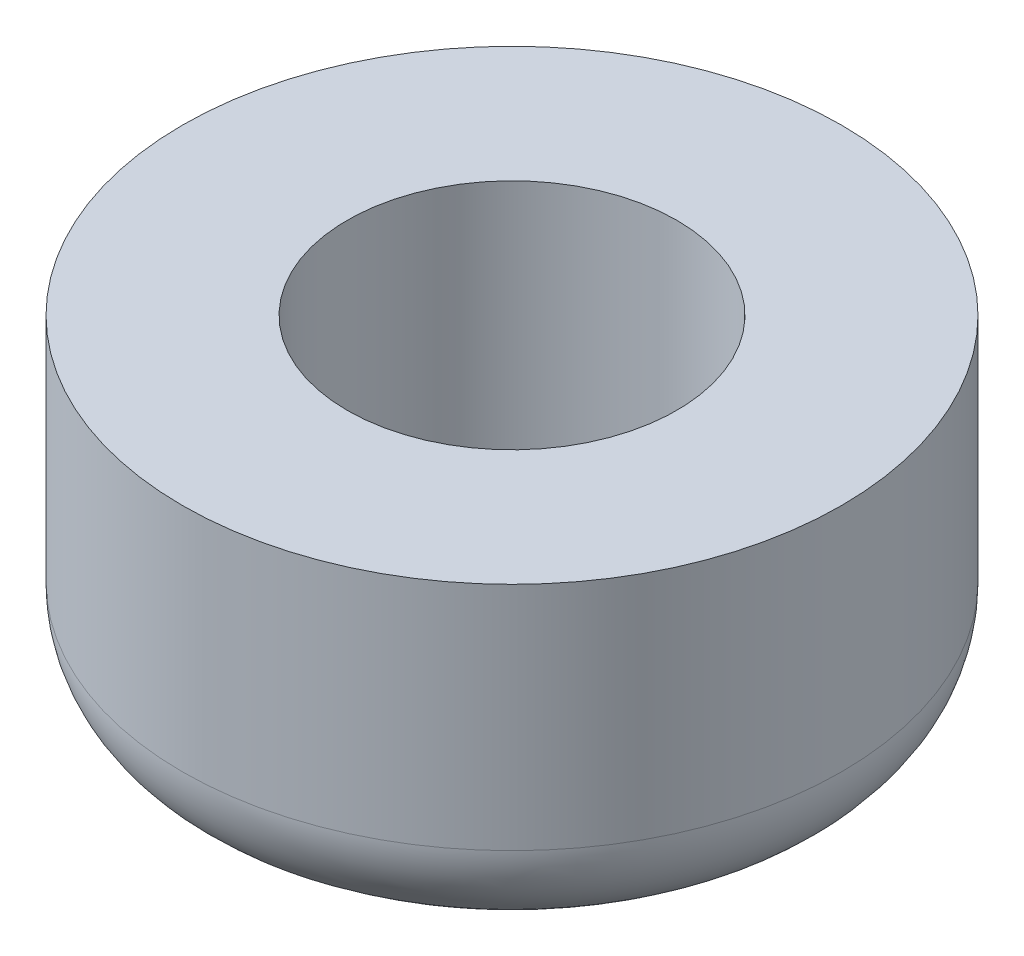
from build123d import *

# Parameters (mm, degrees)
SKETCH_CHECK_VALVE_R   = 10
SKETCH_CHECK_VALVE_R_2 = 5
CHECK_VALVE_DEPTH      = 10
FILLET1_R              = 3


with BuildPart() as part:
    # Sketch_Check Valve → Check Valve (new body)
    with BuildSketch(Plane(origin=(0, 0, 0), x_dir=(1, 0, 0), z_dir=(0, 1, 0))):
        Circle(SKETCH_CHECK_VALVE_R)
        Circle(SKETCH_CHECK_VALVE_R_2, mode=Mode.SUBTRACT)
    extrude(amount=-CHECK_VALVE_DEPTH)

    # Fillet1
    fillet1_edges = [part.edges().sort_by_distance(p)[0] for p in [
        (-10, -10, 0),
    ]]
    fillet(fillet1_edges, radius=FILLET1_R)


solid = part.part
